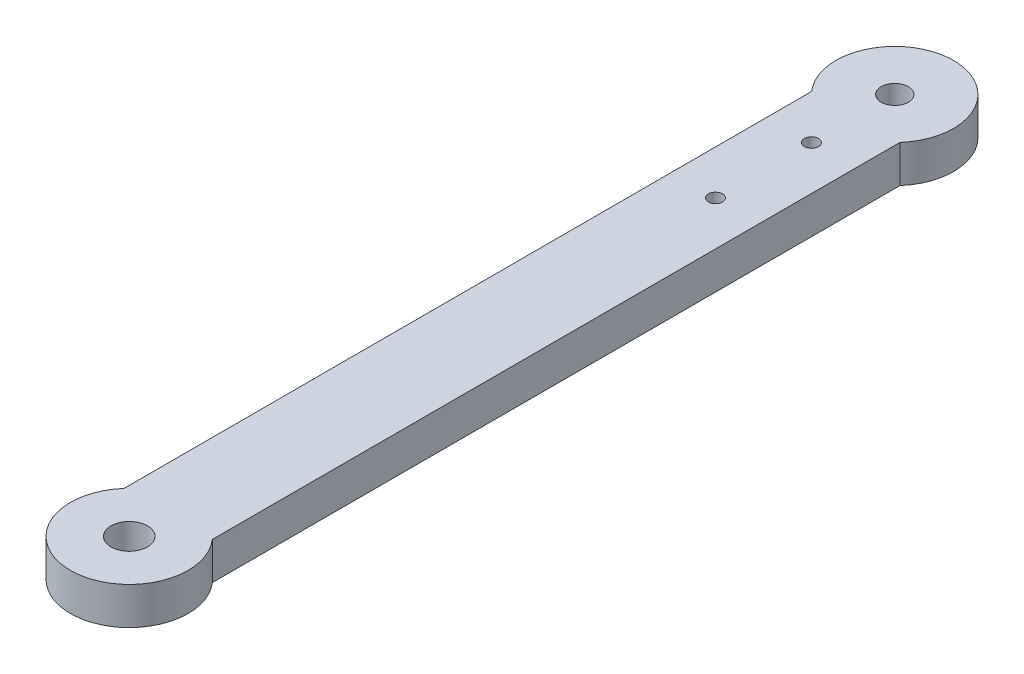
from build123d import *

# Parameters (mm, degrees)
SKETCH1_R           = 1.55
SKETCH1_R_2         = 0.6
SKETCH1_R_3         = 1.15
BOSS_EXTRUDE1_DEPTH = 3.175


with BuildPart() as part:
    # Sketch1 → Boss-Extrude1 (new body)
    with BuildSketch(Plane(origin=(0, 0, 0), x_dir=(1, 0, 0), z_dir=(0, 1, 0))):
        with BuildLine():
            Line((-3.75, -61.692810861), (-3.75, -3.307189139))
            ThreePointArc((-3.75, -3.307189139), (0, 5), (3.75, -3.307189139))
            Line((3.75, -3.307189139), (3.75, -61.692810861))
            ThreePointArc((3.75, -61.692810861), (0, -70), (-3.75, -61.692810861))
        make_face()
        with Locations((0, -65)):
            Circle(SKETCH1_R, mode=Mode.SUBTRACT)
        with Locations((0, -7.07)):
            Circle(SKETCH1_R_2, mode=Mode.SUBTRACT)
        with Locations((0, -15.22)):
            Circle(SKETCH1_R_2, mode=Mode.SUBTRACT)
        Circle(SKETCH1_R_3, mode=Mode.SUBTRACT)
    extrude(amount=BOSS_EXTRUDE1_DEPTH)


solid = part.part
